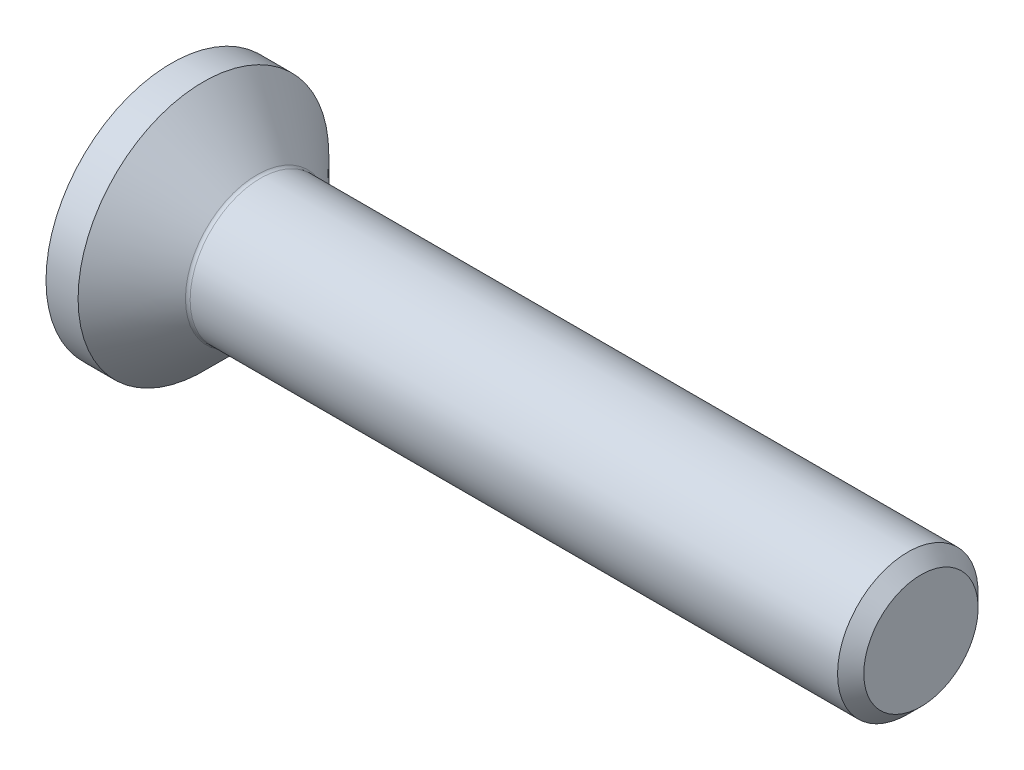
from build123d import *

# Parameters (mm, degrees)
FILLET1_R   = 0.1
HEX_START   = -1.1
HEX_2_DEPTH = 1.1


with BuildPart() as part:
    # BodySke → BaseBody (revolve)
    with BuildSketch(Plane.XY, mode=Mode.PRIVATE) as basebody_sk:
        Polygon((0, 0), (0, 2.675), (0.685, 2.675), (1.86, 1.5), (15.7195, 1.5), (16, 1.2195), (16, 0), align=None)
    revolve(basebody_sk.sketch.rotate(Axis((0, 0, 0), (1, 0, 0)), 90), axis=Axis((0, 0, 0), (1, 0, 0)))

    # Fillet1
    fillet1_edges = [part.edges().sort_by_distance(p)[0] for p in [
        (1.86, 0, -1.5),
    ]]
    fillet(fillet1_edges, radius=FILLET1_R)

    # Hex 2: read off the stored shape, not the designer's step
    # Hex 2 outline → Hex 2 (cut)
    with BuildSketch(Plane.ZY.offset(HEX_START)):
        Polygon((-1, -0.577350269), (0, -1.154700538), (1, -0.577350269), (1, 0.577350269), (0, 1.154700538), (-1, 0.577350269), align=None)
    extrude(amount=HEX_2_DEPTH, mode=Mode.SUBTRACT)

    # Hex 2 2 outline → Hex 2 2 (revolve, cut)
    with BuildSketch(Plane.YX):
        Polygon((1, 1.1), (0, 1.677350269), (0, 1.1), align=None)
    revolve(axis=Axis((0, 0, 0), (1, 0, 0)), mode=Mode.SUBTRACT)


solid = part.part
